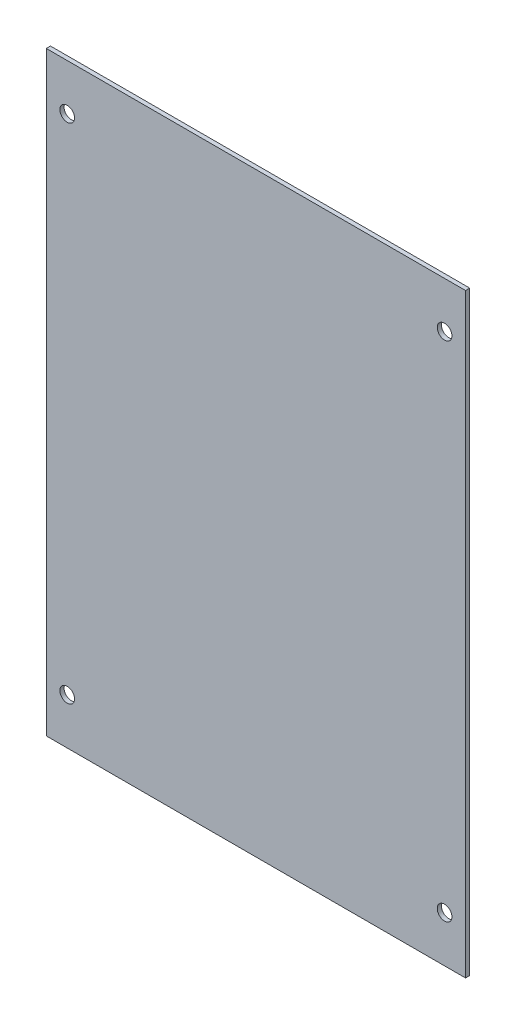
from build123d import *

# Parameters (mm, degrees)
SKETCH2_W           = 100
SKETCH2_H           = 130
BOSS_EXTRUDE1_DEPTH = 1
SKETCH3_R           = 1.75
CUT_EXTRUDE1_DEPTH  = 19
SKETCH5_W           = 100
SKETCH5_H           = 1
BOSS_EXTRUDE2_DEPTH = 6


with BuildPart() as part:
    # Sketch2 → Boss-Extrude1 (new body)
    with BuildSketch(Plane.XY):
        Rectangle(SKETCH2_W, SKETCH2_H)
    extrude(amount=BOSS_EXTRUDE1_DEPTH)

    # Sketch3 → Cut-Extrude1 (cut)
    with BuildSketch(Plane(origin=(0, 0, 0), x_dir=(-1, 0, 0), z_dir=(0, 0, -1))):
        with Locations((-45, -60)):
            Circle(SKETCH3_R)
        with Locations((45, -60)):
            Circle(SKETCH3_R)
        with Locations((45, 60)):
            Circle(SKETCH3_R)
        with Locations((-45, 60)):
            Circle(SKETCH3_R)
    extrude(amount=-CUT_EXTRUDE1_DEPTH, mode=Mode.SUBTRACT)

    # Sketch5 → Boss-Extrude2 (add)
    with BuildSketch(Plane(origin=(0, 65, 0), x_dir=(1, 0, 0), z_dir=(0, 1, 0))):
        with Locations((0, -0.5)):
            Rectangle(SKETCH5_W, SKETCH5_H)
    boss_extrude2 = extrude(amount=BOSS_EXTRUDE2_DEPTH)

    # Mirror1: Boss-Extrude2 across plane
    add(boss_extrude2.mirror(Plane.ZX))


solid = part.part
